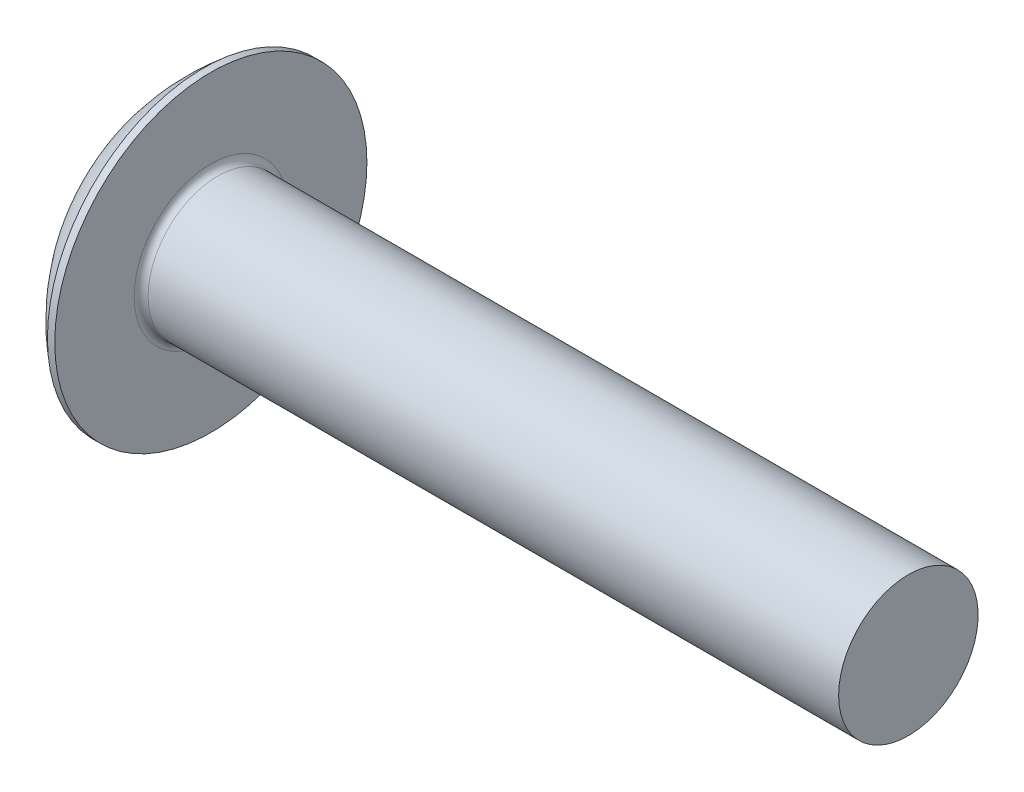
from build123d import *

# Parameters (mm, degrees)
FILLET1_R  = 0.4
SLOTSKE_W  = 17.9
SLOTSKE_H  = 2.31
SLOT_DEPTH = 2.17


with BuildPart() as part:
    # BodySke → BaseBody (revolve)
    with BuildSketch(Plane.XY):
        with BuildLine():
            Line((4.7, 8.95), (4.7, 4))
            Line((4.7, 4), (44.7, 4))
            Line((44.7, 4), (44.7, 0))
            Line((44.7, 0), (0, 0))
            ThreePointArc((0, 0), (1.124663624, 4.960080149), (4.278677406, 8.95))
            Line((4.278677406, 8.95), (4.7, 8.95))
        make_face()
    revolve(axis=Axis((0, 0, 0), (1, 0, 0)))

    # Fillet1
    fillet1_edges = [part.edges().sort_by_distance(p)[0] for p in [
        (4.7, -4, 0),
    ]]
    fillet(fillet1_edges, radius=FILLET1_R)

    # SlotSke → Slot (cut)
    with BuildSketch(Plane(origin=(0, 0, 0), x_dir=(0, 0, -1), z_dir=(1, 0, 0))):
        Rectangle(SLOTSKE_W, SLOTSKE_H)
    extrude(amount=SLOT_DEPTH, mode=Mode.SUBTRACT)


solid = part.part
